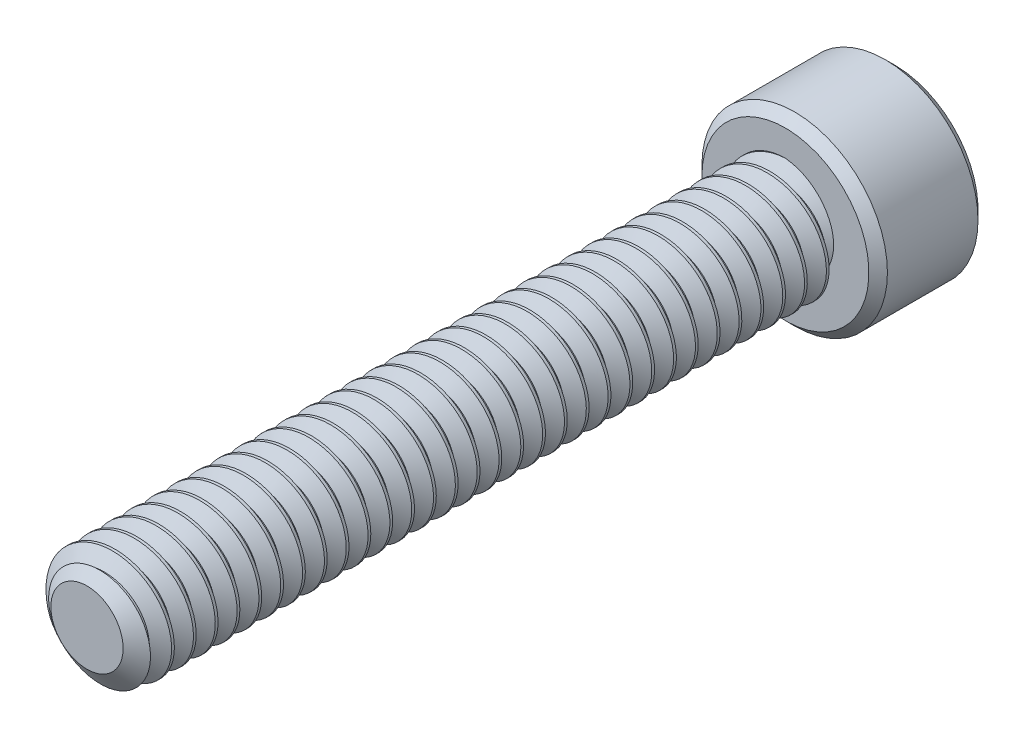
from build123d import *

# Parameters (mm, degrees)
SKETCH1_R          = 2.0828
EXTRUDE1_DEPTH     = 25.4
CUT_SWEEP1_PITCH   = 0.79375
SKETCH6_R          = 3.3734375
EXTRUDE2_DEPTH     = 3.96875
CUT_EXTRUDE1_DEPTH = 2.67890625
CHAMFER1_SIZE      = 0.33734375


with BuildPart() as part:
    # Sketch1 → Extrude1 (new body)
    with BuildSketch(Plane.XY):
        Circle(SKETCH1_R)
    extrude(amount=-EXTRUDE1_DEPTH)

    # Cut-Sweep1: arcs per turn and ends read off the stored shape
    # Cut-Sweep1: the profile of Sketch3 profile screwed along a right-hand helix through 35 turns, 6 arcs to a turn; built about Z, then put on its axis
    cut_sweep1_z = Axis((0, 0, 0), (0, 0, 1))
    cut_sweep1_corners = [(2.0831, 0, -1.488454455), (1.567244252, 0, -1.190625), (1.567244252, 0, -1.09140625), (2.0831, 0, -0.793576795)]
    with BuildLine(mode=Mode.PRIVATE) as cut_sweep1_profile:
        Line(cut_sweep1_corners[0], cut_sweep1_corners[1])
        Line(cut_sweep1_corners[1], cut_sweep1_corners[2])
        Line(cut_sweep1_corners[2], cut_sweep1_corners[3])
        Line(cut_sweep1_corners[3], cut_sweep1_corners[0])
    cut_sweep1_cap = Face(cut_sweep1_profile.wire())
    cut_sweep1_turn_angles = [0, 30, 60, 90, 120, 150, 180, 210, 240, 270, 300, 330, 360]
    cut_sweep1_turn_weights = [1, 0.8660254037844387, 1, 0.8660254037844387, 1, 0.8660254037844387, 1, 0.8660254037844387, 1, 0.8660254037844387, 1, 0.8660254037844387, 1]
    cut_sweep1_turn_rails = [Edge.make_bspline([Vector(p[0], p[1], 0).rotate(cut_sweep1_z, cut_sweep1_turn_angles[k]) / cut_sweep1_turn_weights[k] + Vector(0, 0, p[2] + CUT_SWEEP1_PITCH * cut_sweep1_turn_angles[k] / 360) for k in range(13)], [0, 0, 0, 1, 1, 2, 2, 3, 3, 4, 4, 5, 5, 6, 6, 6], 2, cut_sweep1_turn_weights) for p in cut_sweep1_corners]
    cut_sweep1_turn_sides = [Face.make_surface_from_curves(cut_sweep1_turn_rails[p[0]], cut_sweep1_turn_rails[p[1]]) for p in [(0, 1), (1, 2), (2, 3), (3, 0)]]
    cut_sweep1 = Plane(origin=(0, 0, 0), x_dir=(0, 1, 0), z_dir=(0, 0, -1)) * Solid(Shell([*[p.moved(Location((0, 0, CUT_SWEEP1_PITCH * i))) for i in range(35) for p in cut_sweep1_turn_sides], cut_sweep1_cap, cut_sweep1_cap.rotate(cut_sweep1_z, 12600).moved(Location((0, 0, CUT_SWEEP1_PITCH * 12600 / 360)))]))
    add(cut_sweep1, mode=Mode.SUBTRACT)

    # Sketch4 → Cut-Revolve1 (revolve, cut)
    with BuildSketch(Plane(origin=(0, 0, 0), x_dir=(0, 0, -1), z_dir=(1, 0, 0)), mode=Mode.PRIVATE) as cut_revolve1_sk:
        Polygon((0.538848736, 2.0828), (0, 1.313244252), (0, 2.0828), align=None)
    revolve(cut_revolve1_sk.sketch.rotate(Axis((0, 0, 0), (0, 0, -1)), 261.048315518), axis=Axis((0, 0, 0), (0, 0, -1)), mode=Mode.SUBTRACT)

    # Sketch6 → Extrude2 (add)
    with BuildSketch(Plane(origin=(0, 0, -25.4), x_dir=(-1, 0, 0), z_dir=(0, 0, -1))):
        Circle(SKETCH6_R)
    extrude(amount=EXTRUDE2_DEPTH)

    # Sketch7 → Cut-Extrude1 (cut)
    with BuildSketch(Plane(origin=(0, 0, -29.36875), x_dir=(-1, 0, 0), z_dir=(0, 0, -1))):
        Polygon((0, 2.062222993), (-1.7859375, 1.031111496), (-1.7859375, -1.031111496), (0, -2.062222993), (1.7859375, -1.031111496), (1.7859375, 1.031111496), align=None)
    extrude(amount=-CUT_EXTRUDE1_DEPTH, mode=Mode.SUBTRACT)

    # Cut-Extrude2 cone 1 section (through the dimple's axis) → Cut-Extrude2 (revolve, cut)
    with BuildSketch(Plane(origin=(0, 0, -29.36875), x_dir=(0, 1, 0), z_dir=(1, 0, 0))):
        Polygon((0, 0), (2.062222993, 0), (0, 2.062222993), align=None)
    revolve(axis=Axis((0, 0, -29.36875), (0, 0, 1)), mode=Mode.SUBTRACT)

    # Chamfer1
    chamfer1_edges = [part.edges().sort_by_distance(p)[0] for p in [
        (3.3734375, 0, -25.4),
        (3.3734375, 0, -29.36875),
    ]]
    chamfer(chamfer1_edges, length=CHAMFER1_SIZE)


solid = part.part
